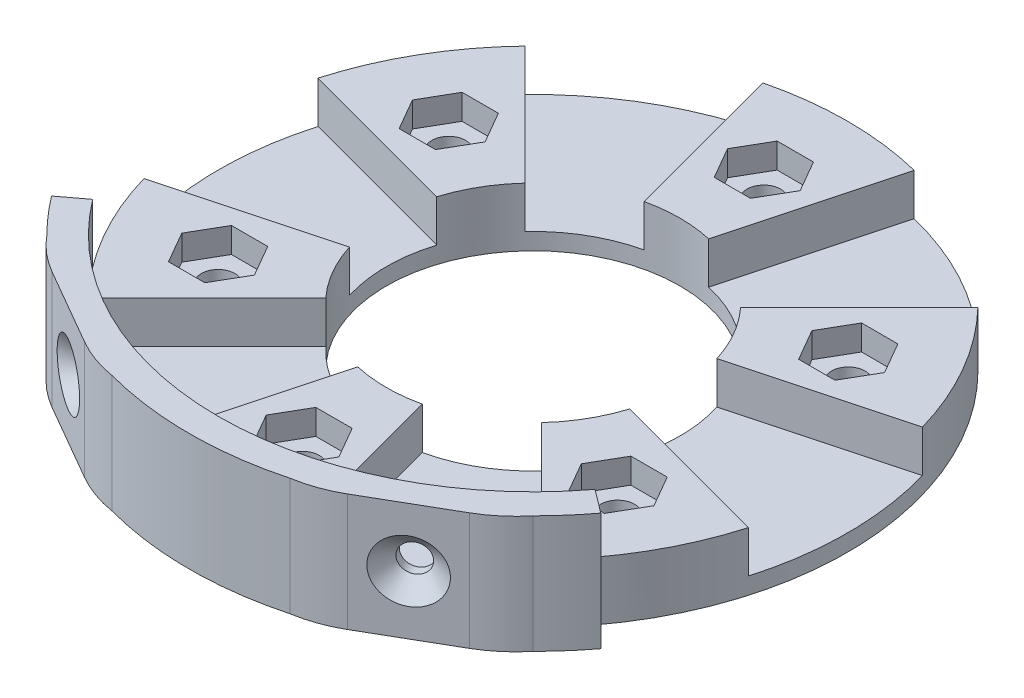
from build123d import *

# Parameters (mm, degrees)
BOSS_EXTRUDE2_DEPTH = 3
BOSS_EXTRUDE3_START = 2
SKETCH2_R           = 2
BOSS_EXTRUDE3_DEPTH = 2
BOSS_EXTRUDE4_START = 2
SKETCH3_R           = 37.5
SKETCH3_R_2         = 17.5
SKETCH3_R_3         = 2
BOSS_EXTRUDE4_DEPTH = 2
BOSS_EXTRUDE5_DEPTH = 14
FILLET1_R           = 15
CUT_EXTRUDE1_DEPTH  = 4
CUT_EXTRUDE2_DEPTH  = 4
CHAMFER2_SIZE       = 2


with BuildPart() as part:
    # Sketch1 → Boss-Extrude2 (new body)
    # profile 1 of 9: a face of its own
    with BuildSketch(Plane(origin=(0, 0, 0), x_dir=(1, 0, 0), z_dir=(0, 1, 0))):
        with BuildLine():
            ThreePointArc((-3.849560294, 17.071346917), (-1.936676142, 17.392506591), (0, 17.5))
            Line((0, 17.5), (0, 23.75))
            Line((0, 23.75), (-2.165063509, 23.75))
            Line((-2.165063509, 23.75), (-4.330127019, 27.5))
            Line((-4.330127019, 27.5), (-2.165063509, 31.25))
            Line((-2.165063509, 31.25), (0, 31.25))
            Line((0, 31.25), (0, 37.5))
            ThreePointArc((0, 37.5), (-4.547498174, 37.223248923), (-9.027875015, 36.397080552))
            Line((-9.027875015, 36.397080552), (-3.849560294, 17.071346917))
        make_face()
    # profile 2 of 9: a face of its own
    with BuildSketch(Plane(origin=(0, 0, 0), x_dir=(1, 0, 0), z_dir=(0, 1, 0))):
        with BuildLine():
            Line((3.849560294, 17.071346917), (9.027875015, 36.397080552))
            ThreePointArc((9.027875015, 36.397080552), (4.547498174, 37.223248923), (0, 37.5))
            Line((0, 37.5), (0, 31.25))
            Line((0, 31.25), (2.165063509, 31.25))
            Line((2.165063509, 31.25), (4.330127019, 27.5))
            Line((4.330127019, 27.5), (2.165063509, 23.75))
            Line((2.165063509, 23.75), (0, 23.75))
            Line((0, 23.75), (0, 17.5))
            ThreePointArc((0, 17.5), (1.936676142, 17.392506591), (3.849560294, 17.071346917))
        make_face()
    # profile 3 of 9: a face of its own
    with BuildSketch(Plane(origin=(0, 0, 0), x_dir=(1, 0, 0), z_dir=(0, 1, 0))):
        with BuildLine():
            Line((-36.034733889, 10.380171171), (-16.709000253, 5.201856451))
            ThreePointArc((-16.709000253, 5.201856451), (-15.155444566, 8.75), (-12.85943996, 11.869490466))
            Line((-12.85943996, 11.869490466), (-27.006858875, 26.016909381))
            ThreePointArc((-27.006858875, 26.016909381), (-32.475952642, 18.75), (-36.034733889, 10.380171171))
        make_face()
        Polygon((-21.650635095, 10), (-25.980762114, 10), (-28.145825623, 13.75), (-25.980762114, 17.5), (-21.650635095, 17.5), (-19.485571585, 13.75), align=None, mode=Mode.SUBTRACT)
    # profile 4 of 9: a face of its own
    with BuildSketch(Plane(origin=(0, 0, 0), x_dir=(1, 0, 0), z_dir=(0, 1, 0))):
        with BuildLine():
            Line((19.485571585, 13.75), (21.650635095, 17.5))
            Line((21.650635095, 17.5), (24.609026292, 17.5))
            Line((24.609026292, 17.5), (26.250883265, 25.260933771))
            Line((26.250883265, 25.260933771), (12.85943996, 11.869490466))
            ThreePointArc((12.85943996, 11.869490466), (14.094014472, 10.373464034), (15.155444566, 8.75))
            Line((15.155444566, 8.75), (20.56810334, 11.875))
            Line((20.56810334, 11.875), (19.485571585, 13.75))
        make_face()
    # profile 5 of 9: a face of its own
    with BuildSketch(Plane(origin=(0, 0, 0), x_dir=(1, 0, 0), z_dir=(0, 1, 0))):
        with BuildLine():
            Line((21.650635095, 10), (20.56810334, 11.875))
            Line((20.56810334, 11.875), (15.155444566, 8.75))
            ThreePointArc((15.155444566, 8.75), (16.030690615, 7.019042557), (16.709000253, 5.201856451))
            Line((16.709000253, 5.201856451), (36.034733889, 10.380171171))
            ThreePointArc((36.034733889, 10.380171171), (34.510028266, 14.673375519), (32.475952642, 18.75))
            Line((32.475952642, 18.75), (27.063293868, 15.625))
            Line((27.063293868, 15.625), (28.145825623, 13.75))
            Line((28.145825623, 13.75), (25.980762114, 10))
            Line((25.980762114, 10), (21.650635095, 10))
        make_face()
    # profile 6 of 9: a face of its own
    with BuildSketch(Plane(origin=(0, 0, 0), x_dir=(1, 0, 0), z_dir=(0, 1, 0))):
        with BuildLine():
            Line((26.250883265, 25.260933771), (24.609026292, 17.5))
            Line((24.609026292, 17.5), (25.980762114, 17.5))
            Line((25.980762114, 17.5), (27.063293868, 15.625))
            Line((27.063293868, 15.625), (32.475952642, 18.75))
            ThreePointArc((32.475952642, 18.75), (29.962530091, 22.549873404), (27.006858875, 26.016909381))
            Line((27.006858875, 26.016909381), (26.250883265, 25.260933771))
        make_face()
    # profile 7 of 9: a face of its own
    with BuildSketch(Plane(origin=(0, 0, 0), x_dir=(1, 0, 0), z_dir=(0, 1, 0))):
        with BuildLine():
            Line((36.034733889, -10.380171171), (16.709000253, -5.201856451))
            ThreePointArc((16.709000253, -5.201856451), (15.155444566, -8.75), (12.85943996, -11.869490466))
            Line((12.85943996, -11.869490466), (27.006858875, -26.016909381))
            ThreePointArc((27.006858875, -26.016909381), (32.475952642, -18.75), (36.034733889, -10.380171171))
        make_face()
        Polygon((21.650635095, -10), (25.980762114, -10), (28.145825623, -13.75), (25.980762114, -17.5), (21.650635095, -17.5), (19.485571585, -13.75), align=None, mode=Mode.SUBTRACT)
    # profile 8 of 9: a face of its own
    with BuildSketch(Plane(origin=(0, 0, 0), x_dir=(1, 0, 0), z_dir=(0, 1, 0))):
        with BuildLine():
            Line((9.027875015, -36.397080552), (3.849560294, -17.071346917))
            ThreePointArc((3.849560294, -17.071346917), (0, -17.5), (-3.849560294, -17.071346917))
            Line((-3.849560294, -17.071346917), (-9.027875015, -36.397080552))
            ThreePointArc((-9.027875015, -36.397080552), (0, -37.5), (9.027875015, -36.397080552))
        make_face()
        Polygon((2.165063509, -23.75), (4.330127019, -27.5), (2.165063509, -31.25), (-2.165063509, -31.25), (-4.330127019, -27.5), (-2.165063509, -23.75), align=None, mode=Mode.SUBTRACT)
    # profile 9 of 9: a face of its own
    with BuildSketch(Plane(origin=(0, 0, 0), x_dir=(1, 0, 0), z_dir=(0, 1, 0))):
        with BuildLine():
            Line((-27.006858875, -26.016909381), (-12.85943996, -11.869490466))
            ThreePointArc((-12.85943996, -11.869490466), (-15.155444566, -8.75), (-16.709000253, -5.201856451))
            Line((-16.709000253, -5.201856451), (-36.034733889, -10.380171171))
            ThreePointArc((-36.034733889, -10.380171171), (-32.475952642, -18.75), (-27.006858875, -26.016909381))
        make_face()
        Polygon((-19.485571585, -13.75), (-21.650635095, -17.5), (-25.980762114, -17.5), (-28.145825623, -13.75), (-25.980762114, -10), (-21.650635095, -10), align=None, mode=Mode.SUBTRACT)
    extrude(amount=BOSS_EXTRUDE2_DEPTH)

    # Sketch2 → Boss-Extrude3 (add)
    # profile 1 of 6: a face of its own
    with BuildSketch(Plane(origin=(0, 0, 0), x_dir=(-1, 0, 0), z_dir=(0, -1, 0)).offset(BOSS_EXTRUDE3_START)):
        with BuildLine():
            ThreePointArc((12.85943996, 11.869490466), (15.155444566, 8.75), (16.709000253, 5.201856451))
            Line((16.709000253, 5.201856451), (36.034733889, 10.380171171))
            ThreePointArc((36.034733889, 10.380171171), (32.475952642, 18.75), (27.006858875, 26.016909381))
            Line((27.006858875, 26.016909381), (12.85943996, 11.869490466))
        make_face()
        with Locations(Location((23.815698604, 13.75, 0), (0, 0, 90))):
            Circle(SKETCH2_R, mode=Mode.SUBTRACT)
    # profile 2 of 6: a face of its own
    with BuildSketch(Plane(origin=(0, 0, 0), x_dir=(-1, 0, 0), z_dir=(0, -1, 0)).offset(BOSS_EXTRUDE3_START)):
        with BuildLine():
            Line((36.034733889, -10.380171171), (16.709000253, -5.201856451))
            ThreePointArc((16.709000253, -5.201856451), (15.155444566, -8.75), (12.85943996, -11.869490466))
            Line((12.85943996, -11.869490466), (27.006858875, -26.016909381))
            ThreePointArc((27.006858875, -26.016909381), (32.475952642, -18.75), (36.034733889, -10.380171171))
        make_face()
        with Locations(Location((23.815698604, -13.75, 0), (0, 0, 90))):
            Circle(SKETCH2_R, mode=Mode.SUBTRACT)
    # profile 3 of 6: a face of its own
    with BuildSketch(Plane(origin=(0, 0, 0), x_dir=(-1, 0, 0), z_dir=(0, -1, 0)).offset(BOSS_EXTRUDE3_START)):
        with BuildLine():
            ThreePointArc((-3.849560294, 17.071346917), (0, 17.5), (3.849560294, 17.071346917))
            Line((3.849560294, 17.071346917), (9.027875015, 36.397080552))
            ThreePointArc((9.027875015, 36.397080552), (0, 37.5), (-9.027875015, 36.397080552))
            Line((-9.027875015, 36.397080552), (-3.849560294, 17.071346917))
        make_face()
        with Locations(Location((0, 27.5, 0), (0, 0, 90))):
            Circle(SKETCH2_R, mode=Mode.SUBTRACT)
    # profile 4 of 6: a face of its own
    with BuildSketch(Plane(origin=(0, 0, 0), x_dir=(-1, 0, 0), z_dir=(0, -1, 0)).offset(BOSS_EXTRUDE3_START)):
        with BuildLine():
            Line((9.027875015, -36.397080552), (3.849560294, -17.071346917))
            ThreePointArc((3.849560294, -17.071346917), (0, -17.5), (-3.849560294, -17.071346917))
            Line((-3.849560294, -17.071346917), (-9.027875015, -36.397080552))
            ThreePointArc((-9.027875015, -36.397080552), (0, -37.5), (9.027875015, -36.397080552))
        make_face()
        with Locations(Location((0, -27.5, 0), (0, 0, 90))):
            Circle(SKETCH2_R, mode=Mode.SUBTRACT)
    # profile 5 of 6: a face of its own
    with BuildSketch(Plane(origin=(0, 0, 0), x_dir=(-1, 0, 0), z_dir=(0, -1, 0)).offset(BOSS_EXTRUDE3_START)):
        with BuildLine():
            ThreePointArc((-16.709000253, 5.201856451), (-15.155444566, 8.75), (-12.85943996, 11.869490466))
            Line((-12.85943996, 11.869490466), (-27.006858875, 26.016909381))
            ThreePointArc((-27.006858875, 26.016909381), (-32.475952642, 18.75), (-36.034733889, 10.380171171))
            Line((-36.034733889, 10.380171171), (-16.709000253, 5.201856451))
        make_face()
        with Locations(Location((-23.815698604, 13.75, 0), (0, 0, 90))):
            Circle(SKETCH2_R, mode=Mode.SUBTRACT)
    # profile 6 of 6: a face of its own
    with BuildSketch(Plane(origin=(0, 0, 0), x_dir=(-1, 0, 0), z_dir=(0, -1, 0)).offset(BOSS_EXTRUDE3_START)):
        with BuildLine():
            Line((-27.006858875, -26.016909381), (-12.85943996, -11.869490466))
            ThreePointArc((-12.85943996, -11.869490466), (-15.155444566, -8.75), (-16.709000253, -5.201856451))
            Line((-16.709000253, -5.201856451), (-36.034733889, -10.380171171))
            ThreePointArc((-36.034733889, -10.380171171), (-32.475952642, -18.75), (-27.006858875, -26.016909381))
        make_face()
        with Locations(Location((-23.815698604, -13.75, 0), (0, 0, 90))):
            Circle(SKETCH2_R, mode=Mode.SUBTRACT)
    extrude(amount=-BOSS_EXTRUDE3_DEPTH)

    # Sketch3 → Boss-Extrude4 (add)
    with BuildSketch(Plane(origin=(0, -2, 0), x_dir=(-1, 0, 0), z_dir=(0, -1, 0)).offset(BOSS_EXTRUDE4_START)):
        with Locations(Location((0, 0, 0), (0, 0, 90))):
            Circle(SKETCH3_R)
        with Locations(Location((0, 0, 0), (0, 0, 90))):
            Circle(SKETCH3_R_2, mode=Mode.SUBTRACT)
        with Locations(Location((0, 27.5, 0), (0, 0, 90))):
            Circle(SKETCH3_R_3, mode=Mode.SUBTRACT)
        with Locations(Location((23.815698604, 13.75, 0), (0, 0, 90))):
            Circle(SKETCH3_R_3, mode=Mode.SUBTRACT)
        with Locations(Location((23.815698604, -13.75, 0), (0, 0, 90))):
            Circle(SKETCH3_R_3, mode=Mode.SUBTRACT)
        with Locations(Location((0, -27.5, 0), (0, 0, 90))):
            Circle(SKETCH3_R_3, mode=Mode.SUBTRACT)
        with Locations(Location((-23.815698604, -13.75, 0), (0, 0, 90))):
            Circle(SKETCH3_R_3, mode=Mode.SUBTRACT)
        with Locations(Location((-23.815698604, 13.75, 0), (0, 0, 90))):
            Circle(SKETCH3_R_3, mode=Mode.SUBTRACT)
    extrude(amount=-BOSS_EXTRUDE4_DEPTH)

    # Sketch4 → Boss-Extrude5 (add)
    with BuildSketch(Plane(origin=(0, -4, 0), x_dir=(-1, 0, 0), z_dir=(0, -1, 0))):
        with BuildLine():
            Line((32.740350171, -24.679332865), (29.94544223, -22.572560548))
            ThreePointArc((29.94544223, -22.572560548), (0, -37.5), (-29.94544223, -22.572560548))
            Line((-29.94544223, -22.572560548), (-32.740350171, -24.679332865))
            ThreePointArc((-32.740350171, -24.679332865), (-30.941073026, -26.900743484), (-28.991378029, -28.991378029))
            Line((-28.991378029, -28.991378029), (-29.69848481, -29.69848481))
            Line((-29.69848481, -29.69848481), (-10.870399894, -40.568884704))
            Line((-10.870399894, -40.568884704), (-10.611580849, -39.602958878))
            ThreePointArc((-10.611580849, -39.602958878), (0, -41), (10.611580849, -39.602958878))
            Line((10.611580849, -39.602958878), (10.870399894, -40.568884704))
            Line((10.870399894, -40.568884704), (29.69848481, -29.69848481))
            Line((29.69848481, -29.69848481), (28.991378029, -28.991378029))
            ThreePointArc((28.991378029, -28.991378029), (30.941073026, -26.900743484), (32.740350171, -24.679332865))
        make_face()
    extrude(amount=-BOSS_EXTRUDE5_DEPTH)

    # Fillet1
    # the kernel refuses this fillet: 15 mm, written as the material it takes off along each edge
    with BuildSketch(Plane(origin=(29.69848481, -17.886373995, 29.69848481), x_dir=(-0.707106781186544, 0, -0.7071067811865511), z_dir=(0, 1, 0)), Plane(origin=(-10.870399894, -17.886373995, 40.568884704), x_dir=(0.25881904510252357, 0, -0.9659258262890675), z_dir=(0, 1, 0))) as fillet1_piece_1:
        with BuildLine():
            CenterArc((15.926510617, 1.482997233), FILLET1_R, 165, 20.67390123)
            Line((1.437623223, 5.36528291), (0, 0))
            Line((0, 0), (1, 0))
        make_face()
    extrude(amount=41.772747989, mode=Mode.SUBTRACT)
    with BuildSketch(Plane(origin=(10.870399894, -17.886373995, 40.568884704), x_dir=(0.8660254037843682, 0, -0.500000000000122), z_dir=(0, 1, 0)), Plane(origin=(-29.69848481, -17.886373995, 29.69848481), x_dir=(0.8660254037844387, 0, 0.5000000000000001), z_dir=(0, 1, 0))) as fillet1_piece_2:
        with BuildLine():
            CenterArc((5.554549598, 15), FILLET1_R, 249.32609877, 20.67390123)
            Line((0.258819045, 0.965925826), (0, 0))
            Line((0, 0), (5.554549598, 0))
        make_face()
    extrude(amount=41.772747989, mode=Mode.SUBTRACT)

    # Sketch6 → Cut-Extrude1 (cut)
    with BuildSketch(Plane(origin=(20.284442352, 0, 35.133684757), x_dir=(0.8660254037843756, 0, -0.5000000000001092), z_dir=(0.5000000000001092, 0, 0.8660254037843756))):
        with BuildLine():
            Line((1.65, 3), (0, 3))
            Line((0, 3), (0, 1.35))
            ThreePointArc((0, 1.35), (1.166726189, 1.833273811), (1.65, 3))
        make_face()
        with BuildLine():
            Line((0, 1.35), (0, 3))
            Line((0, 3), (-1.65, 3))
            ThreePointArc((-1.65, 3), (-1.166726189, 1.833273811), (0, 1.35))
        make_face()
        with BuildLine():
            Line((0, 4.65), (0, 3))
            Line((0, 3), (1.65, 3))
            ThreePointArc((1.65, 3), (1.166726189, 4.166726189), (0, 4.65))
        make_face()
        with BuildLine():
            Line((-1.65, 3), (0, 3))
            Line((0, 3), (0, 4.65))
            ThreePointArc((0, 4.65), (-1.166726189, 4.166726189), (-1.65, 3))
        make_face()
    extrude(amount=-CUT_EXTRUDE1_DEPTH, mode=Mode.SUBTRACT)

    # Sketch7 → Cut-Extrude2 (cut)
    with BuildSketch(Plane(origin=(-20.284442352, 0, 35.133684757), x_dir=(0.8660254037845003, 0, 0.4999999999998932), z_dir=(-0.49999999999989325, 0, 0.8660254037845004))):
        with BuildLine():
            Line((1.65, 3), (0, 3))
            Line((0, 3), (0, 1.35))
            ThreePointArc((0, 1.35), (1.166726189, 1.833273811), (1.65, 3))
        make_face()
        with BuildLine():
            Line((0, 1.35), (0, 3))
            Line((0, 3), (-1.65, 3))
            ThreePointArc((-1.65, 3), (-1.166726189, 1.833273811), (0, 1.35))
        make_face()
        with BuildLine():
            Line((-1.65, 3), (0, 3))
            Line((0, 3), (0, 4.65))
            ThreePointArc((0, 4.65), (-1.166726189, 4.166726189), (-1.65, 3))
        make_face()
        with BuildLine():
            Line((0, 4.65), (0, 3))
            Line((0, 3), (1.65, 3))
            ThreePointArc((1.65, 3), (1.166726189, 4.166726189), (0, 4.65))
        make_face()
    extrude(amount=-CUT_EXTRUDE2_DEPTH, mode=Mode.SUBTRACT)

    # Chamfer2
    chamfer2_edges = [part.edges().sort_by_distance(p)[0] for p in [
        (20.284442352, 1.35, 35.133684757),
        (-21.713384268, 3, 34.308684757),
    ]]
    chamfer(chamfer2_edges, length=CHAMFER2_SIZE)


solid = part.part
